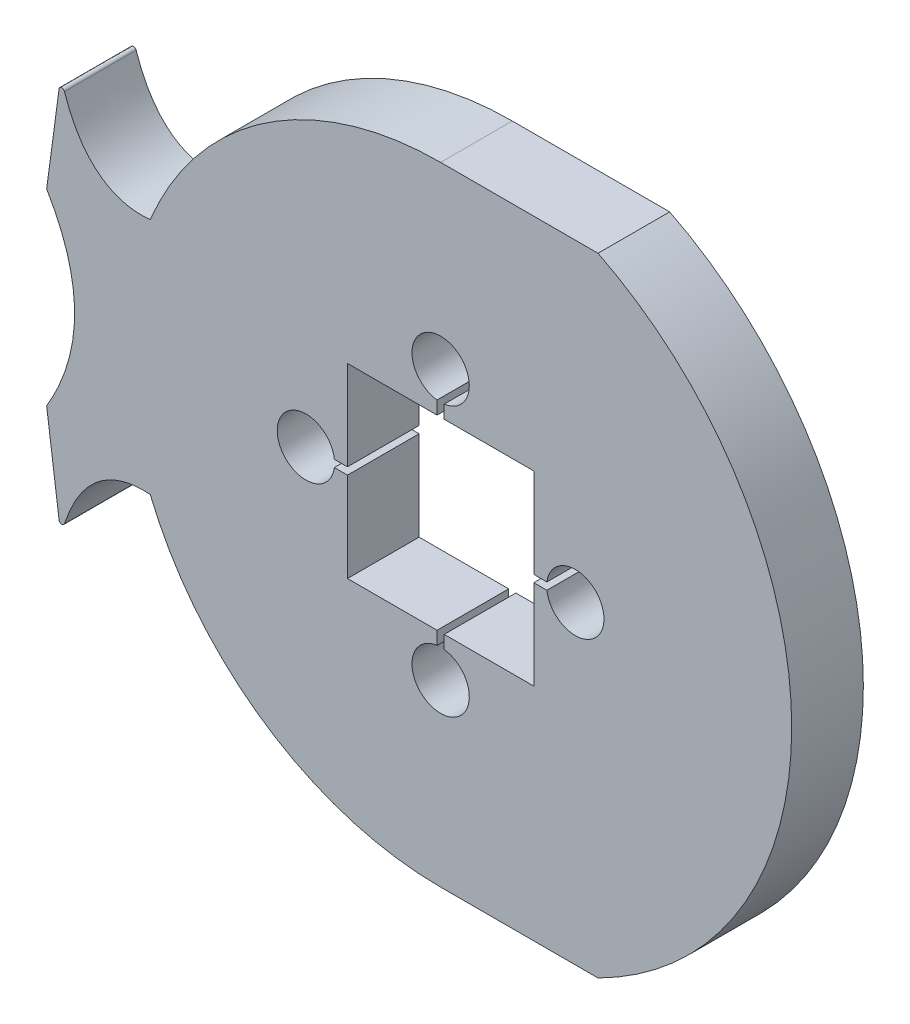
from build123d import *

# Parameters (mm, degrees)
BOSS_EXTRUDE1_DEPTH = 6.35


with BuildPart() as part:
    # Sketch1 → Boss-Extrude1 (new body)
    with BuildSketch(Plane.XY):
        with BuildLine():
            Line((13.949202701, 27.813), (0, 27.813))
            ThreePointArc((0, 27.813), (-15.495722247, 23.096440441), (-25.735880772, 10.546440626))
            add(Edge.make_bspline(
                [(-33.335263894, 16.577622785), (-31.897734861, 12.244147731), (-29.218007482, 10.187725291), (-25.735880772, 10.546440626)],
                knots=[0.081540764, 0.081540764, 0.081540764, 0.081540764, 1, 1, 1, 1], degree=3))
            ThreePointArc((-33.335263894, 16.577622785), (-33.559636624, 16.751099462), (-33.804841532, 16.608579877))
            Line((-33.804841532, 16.608579877), (-34.917209585, 8.319768485))
            add(Edge.make_bspline(
                [(-34.917209585, 8.319768485), (-29.956448806, 0), (-34.917209585, -8.319768485)],
                knots=[0, 0, 0, 1, 1, 1], degree=2))
            Line((-34.917209585, -8.319768485), (-33.804841532, -16.608579877))
            ThreePointArc((-33.804841532, -16.608579877), (-33.559636624, -16.751099462), (-33.335263894, -16.577622785))
            add(Edge.make_bspline(
                [(-33.335263894, -16.577622785), (-31.897734861, -12.244147731), (-29.230448697, -10.289617961), (-25.735880772, -10.546440626)],
                knots=[0.081540764, 0.081540764, 0.081540764, 0.081540764, 1, 1, 1, 1], degree=3))
            ThreePointArc((-25.735880772, -10.546440626), (-15.495722247, -23.096440441), (0, -27.813))
            Line((0, -27.813), (13.949202701, -27.813))
            ThreePointArc((13.949202701, -27.813), (31.115, 0), (13.949202701, 27.813))
        make_face()
        with BuildLine():
            Line((-8.255, 0.3175), (-8.255, 8.255))
            Line((-8.255, 8.255), (-0.3175, 8.255))
            Line((-0.3175, 8.255), (-0.3175, 9.417921876))
            ThreePointArc((-0.3175, 9.417921876), (-1.680052083, 13.843), (2.54, 11.938))
            ThreePointArc((2.54, 11.938), (1.905, 10.257947917), (0.3175, 9.417921876))
            Line((0.3175, 9.417921876), (0.3175, 8.255))
            Line((0.3175, 8.255), (8.255, 8.255))
            Line((8.255, 8.255), (8.255, 0.3175))
            Line((8.255, 0.3175), (9.417921876, 0.3175))
            ThreePointArc((9.417921876, 0.3175), (12.097062198, 2.535014638), (14.478, 0))
            ThreePointArc((14.478, 0), (12.097062198, -2.535014638), (9.417921876, -0.3175))
            Line((9.417921876, -0.3175), (8.255, -0.3175))
            Line((8.255, -0.3175), (8.255, -8.255))
            Line((8.255, -8.255), (0.3175, -8.255))
            Line((0.3175, -8.255), (0.3175, -9.417921876))
            ThreePointArc((0.3175, -9.417921876), (1.905, -10.257947917), (2.54, -11.938))
            ThreePointArc((2.54, -11.938), (-1.680052083, -13.843), (-0.3175, -9.417921876))
            Line((-0.3175, -9.417921876), (-0.3175, -8.255))
            Line((-0.3175, -8.255), (-8.255, -8.255))
            Line((-8.255, -8.255), (-8.255, -0.3175))
            Line((-8.255, -0.3175), (-9.417921876, -0.3175))
            ThreePointArc((-9.417921876, -0.3175), (-14.478, 0), (-9.417921876, 0.3175))
            Line((-9.417921876, 0.3175), (-8.255, 0.3175))
        make_face(mode=Mode.SUBTRACT)
    extrude(amount=BOSS_EXTRUDE1_DEPTH)


solid = part.part
